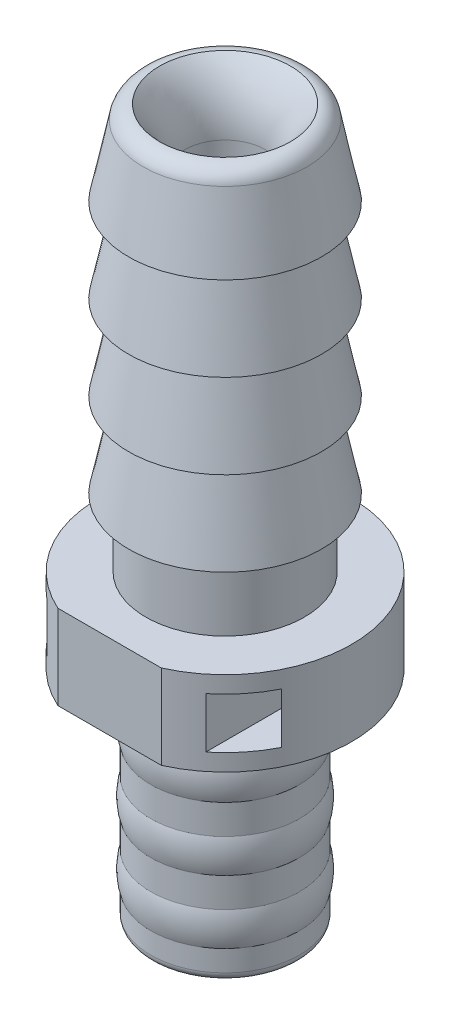
from build123d import *

# Parameters (mm, degrees)
FILLET1_R               = 1
SKETCH2_W               = 2
SKETCH2_H               = 3
CUT_REVOLVE1_ANGLE      = 180
CUT_EXTRUDE1_REACH      = 45.319
CUT_EXTRUDE1_END_RADIUS = 7.5
SKETCH2_3_W             = 2
SKETCH2_3_H             = 3
CUT_EXTRUDE2_REACH      = 32.879
FILLET2_R               = 0.5
FILLET3_R               = 5


with BuildPart() as part:
    # Sketch1 → Revolve1 (revolve)
    with BuildSketch(Plane.XY, mode=Mode.PRIVATE) as revolve1_sk:
        with BuildLine():
            Line((2.4, 42), (2.4, 0))
            Line((2.4, 0), (4.4, 0))
            Line((4.4, 0), (4.4, 1.75))
            ThreePointArc((4.4, 1.75), (4.55, 2.75), (4.4, 3.75))
            Line((4.4, 3.75), (4.4, 5.5))
            ThreePointArc((4.4, 5.5), (4.55, 6.5), (4.4, 7.5))
            Line((4.4, 7.5), (4.4, 9.25))
            ThreePointArc((4.4, 9.25), (4.55, 10.25), (4.4, 11.25))
            Line((4.4, 11.25), (4.4, 13))
            Line((4.4, 13), (7.5, 13))
            Line((7.5, 13), (7.5, 18))
            Line((7.5, 18), (4.7, 18))
            Line((4.7, 18), (4.7, 22))
            Line((4.7, 22), (5.717261497, 22))
            Line((5.717261497, 22), (4.7, 27))
            Line((4.7, 27), (5.717261497, 27))
            Line((5.717261497, 27), (4.7, 32))
            Line((4.7, 32), (5.717261497, 32))
            Line((5.717261497, 32), (4.7, 37))
            Line((4.7, 37), (5.717261497, 37))
            Line((5.717261497, 37), (4.7, 42))
            Line((4.7, 42), (2.4, 42))
        make_face()
    revolve(revolve1_sk.sketch.rotate(Axis((0, 7.836928881, 0), (0, 1, 0)), 90), axis=Axis((0, 7.836928881, 0), (0, 1, 0)))

    # Fillet1
    fillet1_edges = [part.edges().sort_by_distance(p)[0] for p in [
        (0, 42, 4.7),
    ]]
    fillet(fillet1_edges, radius=FILLET1_R)

    # Sketch2 → Cut-Revolve1 (revolve, cut)
    with BuildSketch(Plane.XY):
        with Locations((5.7, 15.5)):
            Rectangle(SKETCH2_W, SKETCH2_H)
    revolve(axis=Axis((0, 0, 0), (0, 1, 0)), revolution_arc=CUT_REVOLVE1_ANGLE, mode=Mode.SUBTRACT)

    # Cut-Extrude1: up to this cylinder (the profile starts inside it)
    cut_extrude1_end = Plane(origin=(0, 15.5, 0), z_dir=(0, -1, 0)) * Cylinder(CUT_EXTRUDE1_END_RADIUS, 106.638, mode=Mode.PRIVATE)
    # Sketch2<3> → Cut-Extrude1 (cut, up to the surface)
    with BuildSketch(Plane.XY, mode=Mode.PRIVATE) as cut_extrude1_sk1:
        with Locations((-5.7, 15.5)):
            Rectangle(SKETCH2_3_W, SKETCH2_3_H)
    cut_extrude1_tool1 = extrude(cut_extrude1_sk1.sketch, amount=CUT_EXTRUDE1_REACH, mode=Mode.PRIVATE) & cut_extrude1_end
    add(cut_extrude1_tool1.solids().sort_by_distance((-5.7, 15.5, 0))[0], mode=Mode.SUBTRACT)
    # Sketch2<3> → Cut-Extrude1 (cut, up to the surface)
    with BuildSketch(Plane.XY, mode=Mode.PRIVATE) as cut_extrude1_sk2:
        with Locations((5.7, 15.5)):
            Rectangle(SKETCH2_3_W, SKETCH2_3_H)
    cut_extrude1_tool2 = extrude(cut_extrude1_sk2.sketch, amount=CUT_EXTRUDE1_REACH, mode=Mode.PRIVATE) & cut_extrude1_end
    add(cut_extrude1_tool2.solids().sort_by_distance((5.7, 15.5, 0))[0], mode=Mode.SUBTRACT)

    # Sketch3 → Cut-Extrude2 (cut, up to next)
    with BuildSketch(Plane.XZ.offset(-13), mode=Mode.PRIVATE) as cut_extrude2_sk1:
        with BuildLine():
            Line((3.066054247, 6.844655678), (-3.066054247, 6.844655678))
            ThreePointArc((-3.066054247, 6.844655678), (0, 7.5), (3.066054247, 6.844655678))
        make_face()
    cut_extrude2_tool1 = extrude(cut_extrude2_sk1.sketch, amount=-CUT_EXTRUDE2_REACH, mode=Mode.PRIVATE) & part.part
    add(cut_extrude2_tool1.solids().sort_by_distance((0, 13, 7.107801))[0], mode=Mode.SUBTRACT)

    # Fillet2
    fillet2_edges = [part.edges().sort_by_distance(p)[0] for p in [
        (0, 0, 4.4),
    ]]
    fillet(fillet2_edges, radius=FILLET2_R)

    # Fillet3
    # the kernel refuses this fillet: 5 mm, written as the material it takes off along each edge
    with BuildSketch(Plane(origin=(0, 0, 0), x_dir=(0, 0, -1), z_dir=(1, 0, 0))) as fillet3_piece_1:
        with BuildLine():
            CenterArc((7.4, 3.570714214), FILLET3_R, 180, 45.572995999)
            Line((2.4, 3.570714214), (2.4, 0))
            Line((2.4, 0), (3.9, 0))
        make_face()
    revolve(axis=Axis((0, 0, 0), (0, 1, 0)), mode=Mode.SUBTRACT)
    with BuildSketch(Plane(origin=(0, 42, 0), x_dir=(0, 0, -1), z_dir=(1, 0, 0))) as fillet3_piece_2:
        with BuildLine():
            CenterArc((7.4, -3.553937245), FILLET3_R, 134.700979484, 45.299020516)
            Line((3.88296573, 0), (2.4, 0))
            Line((2.4, 0), (2.4, -3.553937245))
        make_face()
    revolve(axis=Axis((0, 42, 0), (0, 1, 0)), mode=Mode.SUBTRACT)


solid = part.part
